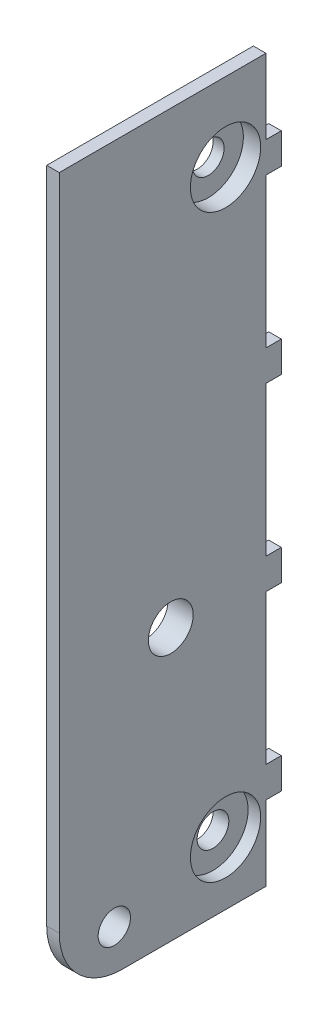
from build123d import *

# Parameters (mm, degrees)
SKETCH1_W            = 200
SKETCH1_H            = 230
BOSS_EXTRUDE1_DEPTH  = 70
SKETCH2_W            = 192
SKETCH2_H            = 222
CUT_EXTRUDE1_DEPTH   = 66
SKETCH4_W            = 196
SKETCH4_H            = 25
CUT_EXTRUDE3_DEPTH   = 10
SKETCH10_R           = 5
CUT_EXTRUDE8_DEPTH   = 167.075284133
SKETCH11_W           = 2
SKETCH11_H           = 10
BOSS_EXTRUDE2_DEPTH  = 20
SKETCH12_W           = 2
SKETCH12_H           = 5
CUT_EXTRUDE9_DEPTH   = 20
FILLET1_R            = 2.5
SKETCH13_W           = 2
SKETCH13_H           = 10
BOSS_EXTRUDE3_DEPTH  = 20
SKETCH14_W           = 2
SKETCH14_H           = 5
CUT_EXTRUDE10_DEPTH  = 20
FILLET2_R            = 2.5
SKETCH15_W           = 192
SKETCH15_H           = 66
CUT_EXTRUDE11_DEPTH  = 267.458251889
BOSS_EXTRUDE4_DEPTH  = 2
SKETCH18_R           = 7.15
CUT_EXTRUDE12_DEPTH  = 248.638849941
SKETCH19_R           = 5.05
CUT_EXTRUDE13_DEPTH  = 248.638849941
SKETCH20_R           = 5.05
CUT_EXTRUDE14_DEPTH  = 248.638849941
BOSS_EXTRUDE5_START  = 2
BOSS_EXTRUDE5_DEPTH  = 2
SKETCH21_W           = 20
SKETCH21_H           = 10
CUT_EXTRUDE15_DEPTH  = 248.638849941
SKETCH22_W           = 92
SKETCH22_H           = 40
CUT_EXTRUDE16_DEPTH  = 10
SKETCH24_R           = 5.15
CUT_EXTRUDE18_DEPTH  = 242.091269025
FILLET3_R            = 20
FILLET4_R            = 20
SKETCH25_W           = 200
SKETCH25_H           = 4.119110625
CUT_EXTRUDE19_DEPTH  = 261.384331326
SKETCH26_W           = 4
SKETCH26_H           = 65.880889375
CUT_EXTRUDE20_DEPTH  = 261.384331326
SKETCH27_W           = 4
SKETCH27_H           = 9.8
BOSS_EXTRUDE6_DEPTH  = 4.9
SKETCH28_W           = 4
SKETCH28_H           = 9.8
BOSS_EXTRUDE7_DEPTH  = 4.9
SKETCH29_R           = 12.5
SKETCH29_R_2         = 5.05
BOSS_EXTRUDE8_DEPTH  = 5
SKETCH30_R           = 8.5
SKETCH30_R_2         = 5.15
BOSS_EXTRUDE9_DEPTH  = 5
SKETCH31_R           = 10
SKETCH31_R_2         = 7.15
BOSS_EXTRUDE10_DEPTH = 4
SKETCH32_R           = 11.2
CUT_EXTRUDE21_DEPTH  = 5.5


with BuildPart() as part:
    # Sketch1 → Boss-Extrude1 (new body)
    with BuildSketch(Plane.XY):
        Rectangle(SKETCH1_W, SKETCH1_H)
    extrude(amount=BOSS_EXTRUDE1_DEPTH)

    # Sketch2 → Cut-Extrude1 (cut)
    with BuildSketch(Plane.XY.offset(70)):
        Rectangle(SKETCH2_W, SKETCH2_H)
    extrude(amount=-CUT_EXTRUDE1_DEPTH, mode=Mode.SUBTRACT)

    # Sketch4 → Cut-Extrude3 (cut)
    with BuildSketch(Plane.XZ.offset(115)):
        with Locations((0, 57.5)):
            Rectangle(SKETCH4_W, SKETCH4_H)
    extrude(amount=-CUT_EXTRUDE3_DEPTH, mode=Mode.SUBTRACT)

    # Sketch10 → Cut-Extrude8 (cut, through all)
    with BuildSketch(Plane.XY.offset(4)):
        with Locations((0, -11)):
            Circle(SKETCH10_R)
    extrude(amount=-CUT_EXTRUDE8_DEPTH, mode=Mode.SUBTRACT)

    # Sketch11 → Boss-Extrude2 (add)
    with BuildSketch(Plane.XY.offset(70)):
        with Locations((-99, -110)):
            Rectangle(SKETCH11_W, SKETCH11_H)
    extrude(amount=BOSS_EXTRUDE2_DEPTH)

    # Sketch12 → Cut-Extrude9 (cut)
    with BuildSketch(Plane.XY.offset(90)):
        with Locations((-99, -110)):
            Rectangle(SKETCH12_W, SKETCH12_H)
    extrude(amount=-CUT_EXTRUDE9_DEPTH, mode=Mode.SUBTRACT)

    # Fillet1
    fillet1_edges = [part.edges().sort_by_distance(p)[0] for p in [
        (-99, -112.5, 70),
        (-99, -107.5, 70),
    ]]
    fillet(fillet1_edges, radius=FILLET1_R - 0.0001)  # a hair under: the kernel refuses the full size

    # Sketch13 → Boss-Extrude3 (add)
    with BuildSketch(Plane.XY.offset(70)):
        with Locations((99, -110)):
            Rectangle(SKETCH13_W, SKETCH13_H)
    extrude(amount=BOSS_EXTRUDE3_DEPTH)

    # Sketch14 → Cut-Extrude10 (cut)
    with BuildSketch(Plane.XY.offset(90)):
        with Locations((99, -110)):
            Rectangle(SKETCH14_W, SKETCH14_H)
    extrude(amount=-CUT_EXTRUDE10_DEPTH, mode=Mode.SUBTRACT)

    # Fillet2
    fillet2_edges = [part.edges().sort_by_distance(p)[0] for p in [
        (99, -112.5, 70),
        (99, -107.5, 70),
    ]]
    fillet(fillet2_edges, radius=FILLET2_R - 0.0001)  # a hair under: the kernel refuses the full size

    # Sketch15 → Cut-Extrude11 (cut, through all)
    with BuildSketch(Plane(origin=(0, 115, 0), x_dir=(1, 0, 0), z_dir=(0, 1, 0))):
        with Locations((0, -37)):
            Rectangle(SKETCH15_W, SKETCH15_H)
    extrude(amount=-CUT_EXTRUDE11_DEPTH, mode=Mode.SUBTRACT)

    # Sketch16 → Boss-Extrude4 (add)
    with BuildSketch(Plane(origin=(-98, 0, 0), x_dir=(0, 0, -1), z_dir=(1, 0, 0))):
        with BuildLine():
            Line((-90, -107.5), (-72.5, -107.5))
            ThreePointArc((-72.5, -107.5), (-70, -110), (-72.5, -112.5))
            Line((-72.5, -112.5), (-90, -112.5))
            Line((-90, -112.5), (-90, -115))
            Line((-90, -115), (-45, -115))
            Line((-45, -115), (-45, -105))
            Line((-45, -105), (-90, -105))
            Line((-90, -105), (-90, -107.5))
        make_face()
    extrude(amount=BOSS_EXTRUDE4_DEPTH)

    # Sketch18 → Cut-Extrude12 (cut, through all)
    with BuildSketch(Plane(origin=(100, 0, 0), x_dir=(0, 0, -1), z_dir=(1, 0, 0))):
        with Locations((-34.45, -28.4)):
            Circle(SKETCH18_R)
    extrude(amount=-CUT_EXTRUDE12_DEPTH, mode=Mode.SUBTRACT)

    # Sketch19 → Cut-Extrude13 (cut, through all)
    with BuildSketch(Plane(origin=(100, 0, 0), x_dir=(0, 0, -1), z_dir=(1, 0, 0))):
        with Locations((-17, -95)):
            Circle(SKETCH19_R)
    extrude(amount=-CUT_EXTRUDE13_DEPTH, mode=Mode.SUBTRACT)

    # Sketch20 → Cut-Extrude14 (cut, through all)
    with BuildSketch(Plane(origin=(100, 0, 0), x_dir=(0, 0, -1), z_dir=(1, 0, 0))):
        with Locations((-17, 90)):
            Circle(SKETCH20_R)
    extrude(amount=-CUT_EXTRUDE14_DEPTH, mode=Mode.SUBTRACT)

    # Sketch17 → Boss-Extrude5 (add)
    with BuildSketch(Plane.ZY.offset(-98).offset(BOSS_EXTRUDE5_START)):
        with BuildLine():
            Line((90, -107.5), (72.5, -107.5))
            ThreePointArc((72.5, -107.5), (70, -110), (72.5, -112.5))
            Line((72.5, -112.5), (90, -112.5))
            Line((90, -112.5), (90, -115))
            Line((90, -115), (45, -115))
            Line((45, -115), (45, -105))
            Line((45, -105), (90, -105))
            Line((90, -105), (90, -107.5))
        make_face()
    extrude(amount=-BOSS_EXTRUDE5_DEPTH)

    # Sketch21 → Cut-Extrude15 (cut, through all)
    with BuildSketch(Plane(origin=(100, 0, 0), x_dir=(0, 0, -1), z_dir=(1, 0, 0))):
        with Locations((-80, -110)):
            Rectangle(SKETCH21_W, SKETCH21_H)
    extrude(amount=-CUT_EXTRUDE15_DEPTH, mode=Mode.SUBTRACT)

    # Sketch22 → Cut-Extrude16 (cut)
    with BuildSketch(Plane.XY.offset(4)):
        with Locations((0, 95)):
            Rectangle(SKETCH22_W, SKETCH22_H)
    extrude(amount=-CUT_EXTRUDE16_DEPTH, mode=Mode.SUBTRACT)

    # Sketch24 → Cut-Extrude18 (cut, through all)
    with BuildSketch(Plane(origin=(100, 0, 0), x_dir=(0, 0, -1), z_dir=(1, 0, 0))):
        with Locations((-52.45, -102)):
            Circle(SKETCH24_R)
    extrude(amount=-CUT_EXTRUDE18_DEPTH, mode=Mode.SUBTRACT)

    # Fillet3
    fillet3_edges = [part.edges().sort_by_distance(p)[0] for p in [
        (98, -115, 70),
    ]]
    fillet(fillet3_edges, radius=FILLET3_R)

    # Fillet4
    fillet4_edges = [part.edges().sort_by_distance(p)[0] for p in [
        (-98, -115, 70),
    ]]
    fillet(fillet4_edges, radius=FILLET4_R)

    # Sketch25 → Cut-Extrude19 (cut, through all)
    with BuildSketch(Plane(origin=(0, 115, 0), x_dir=(1, 0, 0), z_dir=(0, 1, 0))):
        with Locations((0, -2.059555313)):
            Rectangle(SKETCH25_W, SKETCH25_H)
    extrude(amount=-CUT_EXTRUDE19_DEPTH, mode=Mode.SUBTRACT)


with BuildPart() as cut_extrude19_piece_1:
    # of the separate pieces the step leaves, piece 1, a body of its own (cut_extrude19_pieces)
    add(part.part.solids().sort_by_distance((100, -115, 4.119110625))[0])

    # Sketch27 → Boss-Extrude6 (add)
    with BuildSketch(Plane(origin=(0, 0, 4.119110625), x_dir=(-1, 0, 0), z_dir=(0, 0, -1))):
        with Locations((-98, -86.25)):
            Rectangle(SKETCH27_W, SKETCH27_H)
    boss_extrude6 = extrude(amount=BOSS_EXTRUDE6_DEPTH)

    # Sketch28 → Boss-Extrude7 (add)
    with BuildSketch(Plane(origin=(0, 0, 4.119110625), x_dir=(-1, 0, 0), z_dir=(0, 0, -1))):
        with Locations((-98, -28.75)):
            Rectangle(SKETCH28_W, SKETCH28_H)
    boss_extrude7 = extrude(amount=BOSS_EXTRUDE7_DEPTH)

    # Mirror1: Boss-Extrude6, Boss-Extrude7 across plane
    add(boss_extrude6.mirror(Plane.ZX))
    add(boss_extrude7.mirror(Plane.ZX))

    # Sketch29 → Boss-Extrude8 (add)
    with BuildSketch(Plane.ZY.offset(-96)):
        with Locations(Location((17, 90, 0), (0, 0, 180))):
            Circle(SKETCH29_R)
        with Locations(Location((17, 90, 0), (0, 0, 180))):
            Circle(SKETCH29_R_2, mode=Mode.SUBTRACT)
    boss_extrude8 = extrude(amount=BOSS_EXTRUDE8_DEPTH)

    # Sketch30 → Boss-Extrude9 (add)
    with BuildSketch(Plane.ZY.offset(-96)):
        with Locations(Location((52.45, -102, 0), (0, 0, 180))):
            Circle(SKETCH30_R)
        with Locations(Location((52.45, -102, 0), (0, 0, 180))):
            Circle(SKETCH30_R_2, mode=Mode.SUBTRACT)
    extrude(amount=BOSS_EXTRUDE9_DEPTH)

    # Sketch31 → Boss-Extrude10 (add)
    with BuildSketch(Plane.ZY.offset(-96)):
        with Locations(Location((34.45, -28.4, 0), (0, 0, 180))):
            Circle(SKETCH31_R)
        with Locations(Location((34.45, -28.4, 0), (0, 0, 180))):
            Circle(SKETCH31_R_2, mode=Mode.SUBTRACT)
    extrude(amount=BOSS_EXTRUDE10_DEPTH)

    # Sketch32 → Cut-Extrude21 (cut)
    with BuildSketch(Plane(origin=(100, 0, 0), x_dir=(0, 0, -1), z_dir=(1, 0, 0))):
        with Locations((-17, -95)):
            Circle(SKETCH32_R)
    cut_extrude21 = extrude(amount=-CUT_EXTRUDE21_DEPTH, mode=Mode.SUBTRACT)

    # Mirror4: Boss-Extrude8 across plane
    add(boss_extrude8.mirror(Plane.ZX.offset(-2.5)))

    # Mirror5: Cut-Extrude21 across plane
    add(cut_extrude21.mirror(Plane.ZX.offset(-2.5)), mode=Mode.SUBTRACT)


with BuildPart() as cut_extrude19_piece_2:
    # of the separate pieces the step leaves, piece 2, a body of its own (cut_extrude19_pieces)
    add(part.part.solids().sort_by_distance((-100, -115, 50))[0])

    # Sketch26 → Cut-Extrude20 (cut, through all)
    with BuildSketch(Plane(origin=(0, 115, 0), x_dir=(1, 0, 0), z_dir=(0, 1, 0))):
        with Locations((-98, -37.059555313)):
            Rectangle(SKETCH26_W, SKETCH26_H)
    extrude(amount=-CUT_EXTRUDE20_DEPTH, mode=Mode.SUBTRACT)


solid = cut_extrude19_piece_1.part
